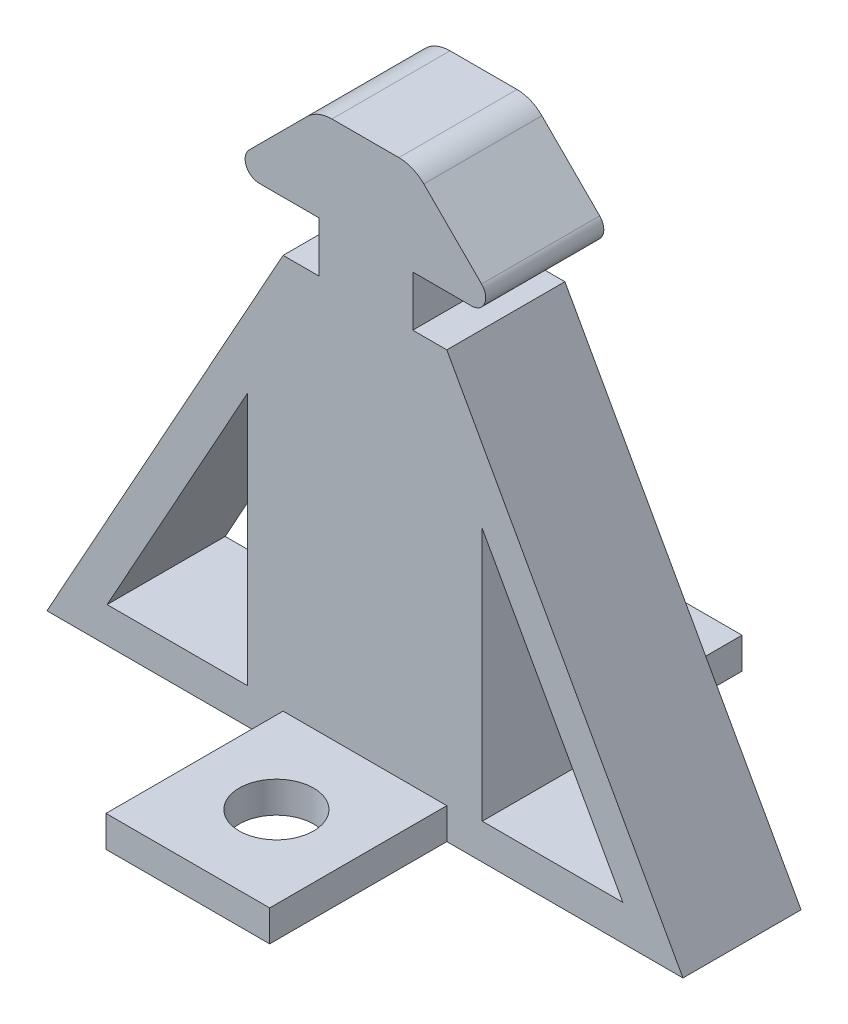
from build123d import *

# Parameters (mm, degrees)
BOSS_EXTRUDE1_DEPTH      = 10
BOSS_EXTRUDE2_DEPTH      = 15
BOSS_EXTRUDE2_DEPTH_BACK = 25
SKETCH2_W                = 13.86324318
SKETCH2_H                = 2.640648634
SKETCH3_R                = 3.15
CUT_EXTRUDE1_DEPTH       = 2.65
BOSS_EXTRUDE3_DEPTH      = 10
SKETCH5_R                = 3.15
CUT_EXTRUDE2_DEPTH       = 10


with BuildPart() as part:
    # Sketch1 → Boss-Extrude1 (new body)
    with BuildSketch(Plane.XY):
        with BuildLine():
            Line((-102.490463188, 678.270987862), (-97.502783366, 678.270987862))
            ThreePointArc((-97.502783366, 678.270987862), (-96.402724844, 679.006023468), (-96.660835024, 680.30363097))
            Line((-96.660835024, 680.30363097), (-101.554583476, 685.197379422))
            ThreePointArc((-101.554583476, 685.197379422), (-102.523344038, 685.844684534), (-103.666075035, 686.071987862))
            Line((-103.666075035, 686.071987862), (-109.332102168, 686.071987862))
            ThreePointArc((-109.332102168, 686.071987862), (-110.474833165, 685.844684534), (-111.443593727, 685.197379422))
            Line((-111.443593727, 685.197379422), (-116.337342179, 680.30363097))
            ThreePointArc((-116.337342179, 680.30363097), (-116.595452359, 679.006023468), (-115.495393837, 678.270987862))
            Line((-115.495393837, 678.270987862), (-112.290288601, 678.270987862))
            Line((-112.290288601, 678.270987862), (-110.43275253, 678.270987862))
            Line((-110.43275253, 678.270987862), (-110.43275253, 674.001864678))
            Line((-110.43275253, 674.001864678), (-113.469742626, 674.001864678))
            Line((-113.469742626, 674.001864678), (-113.469742626, 640.576503739))
            Line((-113.469742626, 640.576503739), (-113.469742626, 637.935000944))
            Line((-113.469742626, 637.935000944), (-99.606499446, 637.935000944))
            Line((-99.606499446, 637.935000944), (-99.606499446, 674.001864678))
            Line((-99.606499446, 674.001864678), (-102.490463188, 674.001864678))
            Line((-102.490463188, 674.001864678), (-102.490463188, 678.270987862))
        make_face()
    extrude(amount=-BOSS_EXTRUDE1_DEPTH)

    # Sketch2 → Boss-Extrude2 (add, two sides: drawn at the far end of the back side and taken through both)
    with BuildSketch(Plane.XY.offset(-BOSS_EXTRUDE2_DEPTH_BACK)):
        with Locations((-106.538121036, 639.255325261)):
            Rectangle(SKETCH2_W, SKETCH2_H)
    extrude(amount=BOSS_EXTRUDE2_DEPTH + BOSS_EXTRUDE2_DEPTH_BACK)

    # Sketch3 → Cut-Extrude1 (cut)
    with BuildSketch(Plane(origin=(0, 640.575649578, 0), x_dir=(1, 0, 0), z_dir=(0, 1, 0))):
        with Locations((-106.538121036, -7.5)):
            Circle(SKETCH3_R)
    extrude(amount=-CUT_EXTRUDE1_DEPTH, mode=Mode.SUBTRACT)

    # Sketch4 → Boss-Extrude3 (add)
    # profile 1 of 2: a face of its own
    with BuildSketch(Plane(origin=(0, 0, -10), x_dir=(-1, 0, 0), z_dir=(0, 0, -1))):
        Polygon((79.606499446, 637.935000944), (99.606499446, 637.935000944), (99.606499446, 674.001864678), align=None)
        Polygon((96.606499446, 640.935000944), (84.700453543, 640.935000944), (96.606499446, 662.405687703), align=None, mode=Mode.SUBTRACT)
    # profile 2 of 2: a face of its own
    with BuildSketch(Plane(origin=(0, 0, -10), x_dir=(-1, 0, 0), z_dir=(0, 0, -1))):
        Polygon((113.469742626, 674.001864678), (113.469742626, 637.935000944), (133.469742626, 637.935000944), align=None)
        Polygon((116.469742626, 640.935000944), (116.469742626, 662.405687703), (128.375788529, 640.935000944), align=None, mode=Mode.SUBTRACT)
    extrude(amount=-BOSS_EXTRUDE3_DEPTH)

    # Sketch5 → Cut-Extrude2 (cut)
    with BuildSketch(Plane(origin=(0, 640.575649578, 0), x_dir=(1, 0, 0), z_dir=(0, 1, 0))):
        with Locations((-106.538121036, 17.5)):
            Circle(SKETCH5_R)
    extrude(amount=-CUT_EXTRUDE2_DEPTH, mode=Mode.SUBTRACT)


solid = part.part
